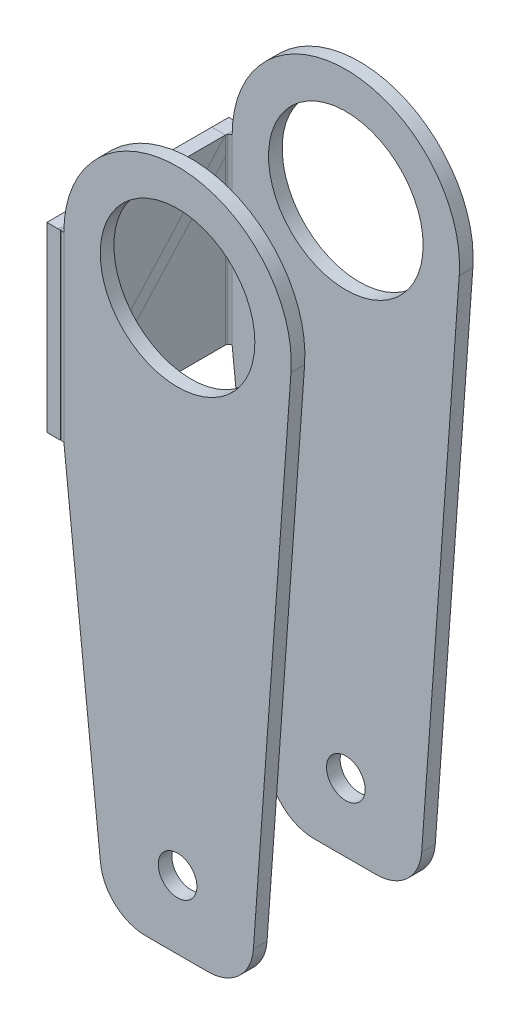
from build123d import *

# Parameters (mm, degrees)
SKETCH1_R          = 17
SKETCH1_R_2        = 4.25
BASE_FLANGE1_DEPTH = 3
EDGE_FLANGE1_DEPTH = 40
FILLET1_R          = 10
FILLET2_R          = 10


# Sheet-metal steps are written as plain solids
with BuildPart() as part:
    # Sketch1 → Base-Flange1 (new body)
    with BuildSketch(Plane.XY):
        with BuildLine():
            Line((0, 40), (0, 0))
            Line((0, 0), (9, -85))
            Line((9, -85), (41, -85))
            Line((41, -85), (49.934509251, 38.191617184))
            ThreePointArc((49.934509251, 38.191617184), (25.904784152, 64.983621948), (0, 40))
        make_face()
        with Locations((25, 40)):
            Circle(SKETCH1_R, mode=Mode.SUBTRACT)
        with Locations((25, -70)):
            Circle(SKETCH1_R_2, mode=Mode.SUBTRACT)
    extrude(amount=-BASE_FLANGE1_DEPTH)

    # Edge-Flange1 section (across the edge) → Edge-Flange1 (add)
    with BuildSketch(Plane(origin=(-0.7366, 40, 0), x_dir=(1, 0, 0), z_dir=(0, -1, 0))):
        with BuildLine():
            Line((-3, 0.7366), (-3, 37))
            Line((-3, 37), (0, 37))
            Line((0, 37), (0, 0.7366))
            ThreePointArc((0, 0.7366), (0.215745145, 0.215745145), (0.7366, 0))
            Line((0.7366, 0), (0.7366, -3))
            ThreePointArc((0.7366, -3), (-1.905575199, -1.905575199), (-3, 0.7366))
        make_face()
    extrude(amount=EDGE_FLANGE1_DEPTH)


with BuildPart() as body_2:
    # Mirror1: mirrored copy
    add(part.part.mirror(Plane(origin=(0, 0, 17), x_dir=(1, 0, 0), z_dir=(0, 0, -1))))

    # Fillet1
    fillet1_edges = [body_2.edges().sort_by_distance(p)[0] for p in [
        (41, -85, 35.5),
        (9, -85, 35.5),
    ]]
    fillet(fillet1_edges, radius=FILLET1_R)


with BuildPart() as part_1:
    add(part.part)

    # Fillet2
    fillet2_edges = [part_1.edges().sort_by_distance(p)[0] for p in [
        (41, -85, -1.5),
        (9, -85, -1.5),
    ]]
    fillet(fillet2_edges, radius=FILLET2_R)


solid = Compound([body_2.part, part_1.part])
